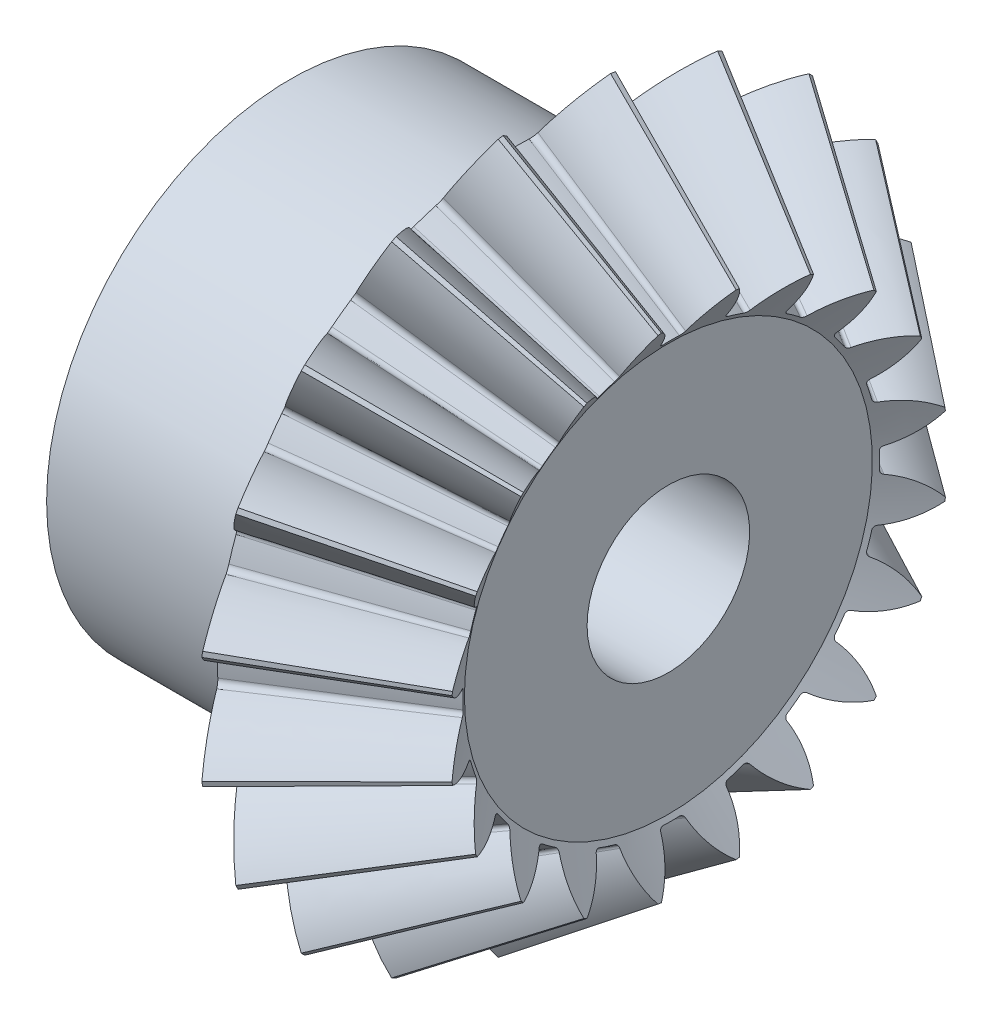
from build123d import *

# Parameters (mm, degrees)
TEETHCUTS_COUNT = 20
TEETHCUTS_ANGLE = 342
HUBSKE_R        = 15
HUB_DEPTH       = 13.706340434
BORSKE_R        = 5
BORE_DEPTH      = 45.0000508


with BuildPart() as part:
    # BasProSke → Base-Revolve (revolve)
    with BuildSketch(Plane(origin=(0, 0, 0), x_dir=(1, 0, 0), z_dir=(0, 1, 0)), mode=Mode.PRIVATE) as base_revolve_sk:
        Polygon((0, 0), (0, 18.059358252), (2.686674995, 22.089370738), (11.414270963, 15.350232676), (9.547260499, 12.549716985), (9.547260499, 0), align=None)
    revolve(base_revolve_sk.sketch.rotate(Axis((-10, 0, 0), (1, 0, 0)), 180), axis=Axis((-10, 0, 0), (1, 0, 0)))

    # ToothCut: read off the stored shape, not the designer's step
    # ToothCut: loft between two sections, ruled curve by curve
    toothcut_from = [
        Edge.make_bspline([(31.298089045, 0.006491816, -0.01002075), (31.294866377, 0.001657814, -0.014544254), (31.290810151, -0.004426525, -0.013682211), (31.288259319, -0.008252772, -0.007931702)], [0, 0, 0, 0, 1, 1, 1, 1], 3, [1, 0.807789157, 0.807789157, 1]),
        Edge.make_bspline([(31.288259319, -0.008252772, 0.007931702), (31.290810151, -0.004426525, 0.013682211), (31.294866377, 0.001657814, 0.014544254), (31.298089045, 0.006491816, 0.01002075)], [0, 0, 0, 0, 1, 1, 1, 1], 3, [1, 0.807789157, 0.807789157, 1]),
        Edge.make_bspline([(31.288259319, -0.008252772, -0.007931702), (31.287864604, -0.008844846, -0.007041869), (31.28753946, -0.009332561, -0.006064847), (31.287289733, -0.009707152, -0.005018198)], [0, 0, 0, 0, 1, 1, 1, 1], 3, [1, 0.994008757, 0.994008757, 1]),
        Edge.make_bspline([(31.287289733, -0.009707152, 0.005018198), (31.28753946, -0.009332561, 0.006064847), (31.287864604, -0.008844846, 0.007041869), (31.288259319, -0.008252772, 0.007931702)], [0, 0, 0, 0, 1, 1, 1, 1], 3, [1, 0.994008757, 0.994008757, 1]),
        Edge.make_bspline([(31.287289733, -0.009707152, -0.005018198), (31.286514409, -0.010870137, -0.001768685), (31.286514409, -0.010870137, 0.001768685), (31.287289733, -0.009707152, 0.005018198)], [0, 0, 0, 0, 1, 1, 1, 1], 3, [1, 0.945749082, 0.945749082, 1]),
        Edge.make_line((31.298089045, 0.006491816, 0.01002075), (31.298089045, 0.006491816, -0.01002075)),
    ]
    toothcut_to = [
        Edge.make_bspline([(2.769904004, 22.214214252, -3.700663777), (2.152577639, 21.288224705, -2.390431489), (1.339504527, 20.068615039, -1.492254722), (0.411660066, 18.67684835, -1.095584497)], [0, 0, 0, 0, 1, 1, 1, 1], 3, [1, 0.96680274, 0.96680274, 1]),
        Edge.make_bspline([(0.411660066, 18.67684835, 1.095584497), (1.339504527, 20.068615039, 1.492254722), (2.152577639, 21.288224705, 2.390431489), (2.769904004, 22.214214252, 3.700663777)], [0, 0, 0, 0, 1, 1, 1, 1], 3, [1, 0.96680274, 0.96680274, 1]),
        Edge.make_bspline([(0.411660066, 18.67684835, -1.095584497), (0.310007012, 18.524368769, -1.052125985), (0.246841088, 18.429619884, -0.902110242), (0.250954026, 18.43578929, -0.713916112)], [0, 0, 0, 0, 1, 1, 1, 1], 3, [1, 0.848062959, 0.848062959, 1]),
        Edge.make_bspline([(0.250954026, 18.43578929, 0.713916112), (0.246841088, 18.429619884, 0.902110242), (0.310007012, 18.524368769, 1.052125985), (0.411660066, 18.67684835, 1.095584497)], [0, 0, 0, 0, 1, 1, 1, 1], 3, [1, 0.848062959, 0.848062959, 1]),
        Edge.make_bspline([(0.250954026, 18.43578929, -0.713916112), (0.26135298, 18.451387722, -0.238095092), (0.26135298, 18.451387722, 0.238095092), (0.250954026, 18.43578929, 0.713916112)], [0, 0, 0, 0, 1, 1, 1, 1], 3, [1, 0.999483169, 0.999483169, 1]),
        Edge.make_line((2.769904004, 22.214214252, 3.700663777), (2.769904004, 22.214214252, -3.700663777)),
    ]
    toothcut = Solid(Shell([*[Face.make_surface_from_curves(toothcut_from[k], toothcut_to[k]) for k in range(6)], Face(Wire(toothcut_from)), Face(Wire(toothcut_to))]))
    add(toothcut, mode=Mode.SUBTRACT)

    # TeethCuts: ToothCut ×20 about axis
    teethcuts_axis = Axis((-10, 0, 0), (1, 0, 0))
    for i in range(1, TEETHCUTS_COUNT):
        add(toothcut.rotate(teethcuts_axis, i * TEETHCUTS_ANGLE / (TEETHCUTS_COUNT - 1)), mode=Mode.SUBTRACT)

    # HubSke → Hub (add)
    with BuildSketch(Plane.ZY):
        with Locations(Location((0, 0, 0), (0, 0, 180))):
            Circle(HUBSKE_R)
    extrude(amount=HUB_DEPTH)

    # BorSke → Bore (cut, symmetric)
    with BuildSketch(Plane(origin=(0, 0, 0), x_dir=(0, 0, -1), z_dir=(1, 0, 0))):
        with Locations(Location((0, 0, 0), (0, 0, 180))):
            Circle(BORSKE_R)
    extrude(amount=BORE_DEPTH, both=True, mode=Mode.SUBTRACT)


solid = part.part
